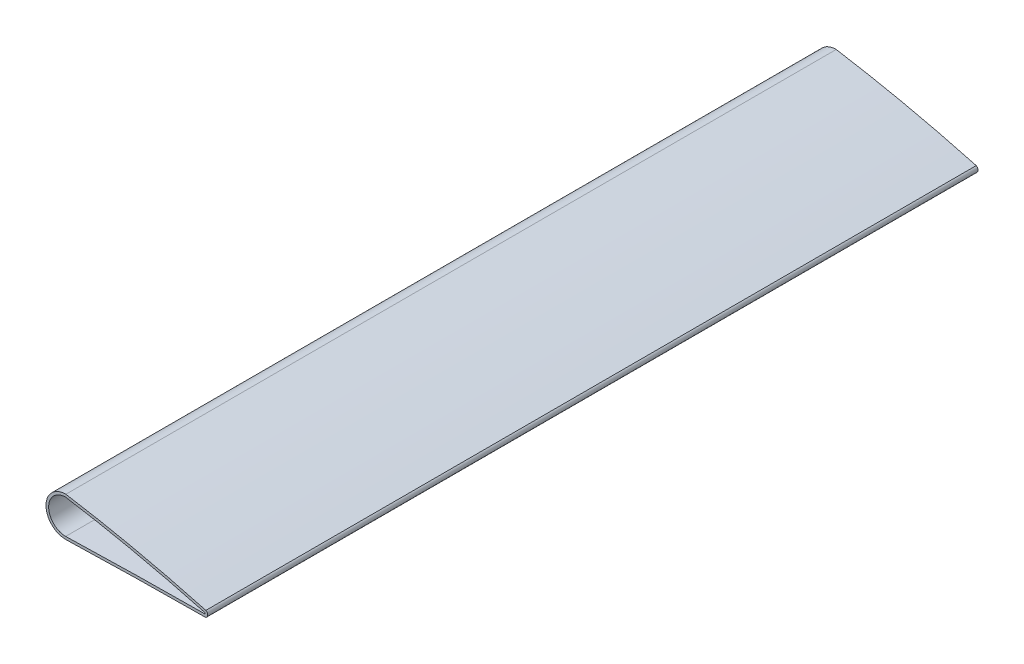
from build123d import *

# Parameters (mm, degrees)
THICKEN_START   = -486
THICKEN_1_DEPTH = 580.4


# Read off the part's stored shape, not the designer's step: Придать толщину1
with BuildPart() as part:
    # Придать толщину1 outline → Придать толщину1 (new body)
    with BuildSketch(Plane.XY.offset(THICKEN_START)):
        with BuildLine():
            ThreePointArc((350.530262234, -2.437269866), (352.176440725, -0.180662049), (350.855908905, 2.280715243))
            add(Edge.make_bspline(
                [(350.855908905, 2.280715243), (350.847341227, 2.283049319), (350.838773452, 2.285383421), (350.830205678, 2.287717523), (350.821637903, 2.290051626), (350.813070129, 2.292385728), (350.804502354, 2.294719831), (350.79593458, 2.297053933), (350.787366805, 2.299388035), (350.778799031, 2.301722138), (350.770231256, 2.30405624), (350.761663481, 2.306390342), (350.753095707, 2.308724445), (350.744527932, 2.311058547), (350.721223101, 2.317407438), (350.706486045, 2.321422226), (350.691748985, 2.325437014), (350.677011935, 2.329451802), (350.662274867, 2.33346659), (350.647537825, 2.337481378), (350.632800752, 2.341496166), (350.61806371, 2.345510955), (350.603326642, 2.349525743), (350.588589592, 2.353540531), (350.573852532, 2.357555319), (350.559115477, 2.361570107), (350.544378419, 2.365584895), (350.522272834, 2.371607077), (350.514923563, 2.373609253), (350.507299128, 2.375686214), (350.500660824, 2.377494496), (350.491767576, 2.379917309), (350.486631802, 2.381315638), (350.476720209, 2.384016224), (350.471520136, 2.385431796), (350.462702931, 2.387833891), (350.456026243, 2.389652051), (350.448396167, 2.391730226), (350.441070823, 2.39372521), (350.433682178, 2.395737404), (350.418917908, 2.399758121), (350.411535758, 2.401768425), (350.404153591, 2.403778673), (350.396771415, 2.405788865), (350.389389211, 2.407799003), (350.382007011, 2.409809085), (350.374624771, 2.411819112), (350.367242542, 2.413829084), (350.359860275, 2.415839001), (350.352478009, 2.417848863), (350.345095717, 2.419858669), (350.337713416, 2.42186842), (350.330331097, 2.423878115), (350.29341943, 2.433926318), (350.26388985, 2.441963997), (350.234360031, 2.450000791), (350.204829954, 2.458036702), (350.175299658, 2.466071729), (350.145769079, 2.474105871), (350.116238304, 2.48213913), (350.086707235, 2.490171505), (350.057175964, 2.498202995), (350.027644418, 2.506233601), (349.998112646, 2.514263323), (349.968580621, 2.52229216), (349.939048354, 2.530320112), (349.791385798, 2.570455453), (349.673251845, 2.602549572), (349.555113982, 2.634629532), (349.436972217, 2.666695331), (349.318826538, 2.698746961), (349.200676964, 2.73078442), (349.082523474, 2.762807702), (348.964366093, 2.794816803), (348.846204799, 2.826811719), (348.728039611, 2.858792444), (348.609870518, 2.890758973), (348.491697528, 2.922711304), (348.373520638, 2.95464943), (348.018978274, 3.050421181), (347.782601108, 3.114212179), (347.546208352, 3.177946305), (347.309800034, 3.241623522), (347.073376117, 3.305243792), (346.836936683, 3.368807079), (346.600481636, 3.432313345), (346.364011103, 3.495762554), (346.127524974, 3.559154669), (345.891023352, 3.622489653), (345.654506179, 3.685767468), (345.417973499, 3.748988079), (345.181425303, 3.812151447), (344.471734205, 4.001469715), (343.998544788, 4.127452777), (343.525293411, 4.253206428), (343.051980133, 4.378730371), (342.578605007, 4.504024311), (342.105168105, 4.629087953), (341.631669461, 4.753921), (341.158109163, 4.878523157), (340.684487238, 5.002894128), (340.210803771, 5.127033617), (339.737058801, 5.25094133), (339.263252398, 5.37461697), (338.789384613, 5.498060241), (337.367597294, 5.867692062), (336.419493796, 6.113182619), (335.47114547, 6.357740155), (334.522552802, 6.601362303), (333.57371621, 6.844046696), (332.624636238, 7.085790972), (331.67531324, 7.32659276), (330.725747809, 7.566449699), (329.775940285, 7.805359421), (328.825891233, 8.04331956), (327.875601051, 8.28032775), (326.92507024, 8.516381626), (325.974299248, 8.751478823), (324.072277843, 9.219755123), (323.121027933, 9.452934456), (322.169538251, 9.685152167), (321.217809283, 9.916405871), (320.265841965, 10.146693371), (319.313637196, 10.376012495), (318.361195636, 10.60436098), (317.408517503, 10.831736422), (316.455602753, 11.058136282), (315.502451221, 11.283557953), (314.549063115, 11.507998879), (313.595439546, 11.731456744), (312.641583319, 11.953929704), (310.733416382, 12.396903683), (309.779104108, 12.617405599), (308.824564208, 12.836922534), (307.86979786, 13.05545458), (306.914806244, 13.273001831), (305.959590541, 13.489564377), (305.004151926, 13.705142311), (304.048491585, 13.919735726), (303.09261069, 14.133344714), (302.136510427, 14.345969368), (301.18019197, 14.557609779), (300.223656501, 14.76826604), (299.266905199, 14.977938243), (296.396007332, 15.604002957), (294.481216806, 16.017443572), (292.565577101, 16.426949065), (290.649097646, 16.832520172), (288.731787881, 17.234157632), (286.813657228, 17.631862182), (284.894715137, 18.02563456), (282.974971019, 18.415475504), (281.054434331, 18.801385751), (279.133114486, 19.183366038), (277.211020932, 19.561417105), (275.288163092, 19.935539688), (273.364550405, 20.305734525), (270.47801325, 20.855136268), (269.515647844, 21.03728843), (268.553097263, 21.218458932), (267.590362686, 21.398647865), (266.62744529, 21.577855323), (265.664346259, 21.756081397), (264.701066764, 21.933326178), (263.737607993, 22.109589761), (262.773971118, 22.284872235), (261.810157321, 22.459173694), (260.846167781, 22.632494229), (259.882003676, 22.804833933), (258.917666186, 22.976192897), (257.47090164, 23.231760373), (256.98860374, 23.31670437), (256.506262936, 23.401403216), (256.023879374, 23.485856924), (255.541453205, 23.570065504), (255.058984569, 23.654028968), (254.576473624, 23.737747329), (254.093920506, 23.821220596), (253.611325372, 23.904448782), (253.128688363, 23.987431898), (252.64600963, 24.070169956), (252.163289318, 24.152662967), (251.680527575, 24.234910943), (250.956323037, 24.357915371), (250.714911203, 24.398855591), (250.473489068, 24.439734557), (250.232056644, 24.480552269), (249.990613966, 24.521308731), (249.749161023, 24.56200394), (249.507697873, 24.602637903), (249.26622449, 24.643210617), (249.024740936, 24.683722086), (248.783247192, 24.72417231), (248.541743303, 24.764561291), (248.300229273, 24.804889031), (248.058705126, 24.84515553), (247.696403756, 24.905463421), (247.575634108, 24.925550742), (247.454861934, 24.945622753), (247.334087249, 24.965679456), (247.213310029, 24.985720848), (247.092530319, 25.005746933), (246.971748063, 25.025757706), (246.85096333, 25.045753174), (246.730176058, 25.065733331), (246.609386302, 25.085698181), (246.488594028, 25.105647723), (246.367799258, 25.125581957), (246.247001987, 25.145500883), (246.096002277, 25.170380406), (246.065802179, 25.175355354), (246.035601922, 25.180329345), (246.00540152, 25.18530238), (245.975200939, 25.190274456), (245.945000238, 25.19524558), (245.914799335, 25.200215742), (245.884598326, 25.205184952), (245.854397116, 25.210153201), (245.824195784, 25.215120496), (245.793994275, 25.220086833), (245.763792621, 25.225052214), (245.733590808, 25.230016638), (245.695838348, 25.236220973), (245.688287846, 25.23746178), (245.680737334, 25.238702527), (245.673186814, 25.239943215), (245.66563628, 25.241183842), (245.658085744, 25.24242441), (245.650535188, 25.243664918), (245.642984633, 25.244905367), (245.635434059, 25.246145755), (245.627883482, 25.247386084), (245.620332891, 25.248626353), (245.612782293, 25.249866562), (245.605231684, 25.251106711), (245.593905756, 25.252966846), (245.590130444, 25.253586876), (245.586355132, 25.254206891), (245.582579811, 25.25482689), (245.5788045, 25.255446876), (245.575029166, 25.256066845), (245.571253858, 25.256686802), (245.567478516, 25.25730674), (245.5637032, 25.257926667), (245.55992786, 25.258546576), (245.556152532, 25.259166472), (245.552377193, 25.259786352), (245.548601856, 25.260406217), (245.542938844, 25.261335993), (245.541051175, 25.261645915), (245.539163499, 25.261955832), (245.537275836, 25.262265747), (245.535388145, 25.262575656), (245.533500499, 25.262885565), (245.531612792, 25.263195464), (245.529725149, 25.263505366), (245.527837448, 25.263815259), (245.52594979, 25.264125152), (245.524062104, 25.26443504), (245.522174431, 25.264744924), (245.520286752, 25.265054804), (245.516511396, 25.265674558), (245.5146231, 25.265984534), (245.512735772, 25.266294338), (245.510851599, 25.266603635), (245.508960848, 25.266914005), (245.507066649, 25.267224925), (245.505180733, 25.267534481), (245.503304717, 25.267842421), (245.501426209, 25.268150777), (245.499536503, 25.268460964), (245.497646641, 25.268771172), (245.495770176, 25.269079189), (245.493883748, 25.269388837), (245.481970707, 25.271344313), (245.471941721, 25.272990529), (245.461912734, 25.274636744), (245.451883748, 25.27628296), (245.441854762, 25.277929176), (245.431825776, 25.279575392), (245.421796789, 25.281221607), (245.411767803, 25.282867823), (245.401738817, 25.284514039), (245.391709831, 25.286160255), (245.381680844, 25.287806471), (245.371651858, 25.289452686), (245.361622872, 25.291098902), (245.351593885, 25.292745118)],
                knots=[-0.003188793, -0.003188793, -0.003188793, -0.003188793, -0.003188793, -0.003188793, -0.003188793, -0.003188793, -0.003188793, -0.003188793, -0.003188793, -0.003188793, -0.003188793, -0.003188793, -0.003188793, -0.002030469, -0.002030469, -0.002030469, -0.002030469, -0.002030469, -0.002030469, -0.002030469, -0.002030469, -0.002030469, -0.002030469, -0.002030469, -0.002030469, -0.002030469, -3.8086e-05, -3.8086e-05, -3.8086e-05, -3.8086e-05, -3.8086e-05, -3.8086e-05, -3.8086e-05, -3.8086e-05, -3.8086e-05, -3.8086e-05, -3.8086e-05, -3.8086e-05, -3.8086e-05, 0.000958105, 0.000958105, 0.000958105, 0.000958105, 0.000958105, 0.000958105, 0.000958105, 0.000958105, 0.000958105, 0.000958105, 0.000958105, 0.000958105, 0.000958105, 0.001954297, 0.001954297, 0.001954297, 0.001954297, 0.001954297, 0.001954297, 0.001954297, 0.001954297, 0.001954297, 0.001954297, 0.001954297, 0.001954297, 0.001954297, 0.005939062, 0.005939062, 0.005939062, 0.005939062, 0.005939062, 0.005939062, 0.005939062, 0.005939062, 0.005939062, 0.005939062, 0.005939062, 0.005939062, 0.005939062, 0.021878125, 0.021878125, 0.021878125, 0.021878125, 0.021878125, 0.021878125, 0.021878125, 0.021878125, 0.021878125, 0.021878125, 0.021878125, 0.021878125, 0.021878125, 0.05375625, 0.05375625, 0.05375625, 0.05375625, 0.05375625, 0.05375625, 0.05375625, 0.05375625, 0.05375625, 0.05375625, 0.05375625, 0.05375625, 0.05375625, 0.1175125, 0.1175125, 0.1175125, 0.1175125, 0.1175125, 0.1175125, 0.1175125, 0.1175125, 0.1175125, 0.1175125, 0.1175125, 0.1175125, 0.1175125, 0.245025, 0.245025, 0.245025, 0.245025, 0.245025, 0.245025, 0.245025, 0.245025, 0.245025, 0.245025, 0.245025, 0.245025, 0.245025, 0.3725375, 0.3725375, 0.3725375, 0.3725375, 0.3725375, 0.3725375, 0.3725375, 0.3725375, 0.3725375, 0.3725375, 0.3725375, 0.3725375, 0.3725375, 0.50005, 0.50005, 0.50005, 0.50005, 0.50005, 0.50005, 0.50005, 0.50005, 0.50005, 0.50005, 0.50005, 0.50005, 0.50005, 0.755075, 0.755075, 0.755075, 0.755075, 0.755075, 0.755075, 0.755075, 0.755075, 0.755075, 0.755075, 0.755075, 0.755075, 0.755075, 0.8825875, 0.8825875, 0.8825875, 0.8825875, 0.8825875, 0.8825875, 0.8825875, 0.8825875, 0.8825875, 0.8825875, 0.8825875, 0.8825875, 0.8825875, 0.94634375, 0.94634375, 0.94634375, 0.94634375, 0.94634375, 0.94634375, 0.94634375, 0.94634375, 0.94634375, 0.94634375, 0.94634375, 0.94634375, 0.94634375, 0.978221875, 0.978221875, 0.978221875, 0.978221875, 0.978221875, 0.978221875, 0.978221875, 0.978221875, 0.978221875, 0.978221875, 0.978221875, 0.978221875, 0.978221875, 0.994160938, 0.994160938, 0.994160938, 0.994160938, 0.994160938, 0.994160938, 0.994160938, 0.994160938, 0.994160938, 0.994160938, 0.994160938, 0.994160938, 0.994160938, 0.998145703, 0.998145703, 0.998145703, 0.998145703, 0.998145703, 0.998145703, 0.998145703, 0.998145703, 0.998145703, 0.998145703, 0.998145703, 0.998145703, 0.998145703, 0.999141895, 0.999141895, 0.999141895, 0.999141895, 0.999141895, 0.999141895, 0.999141895, 0.999141895, 0.999141895, 0.999141895, 0.999141895, 0.999141895, 0.999141895, 0.99963999, 0.99963999, 0.99963999, 0.99963999, 0.99963999, 0.99963999, 0.99963999, 0.99963999, 0.99963999, 0.99963999, 0.99963999, 0.99963999, 0.99963999, 0.999889038, 0.999889038, 0.999889038, 0.999889038, 0.999889038, 0.999889038, 0.999889038, 0.999889038, 0.999889038, 0.999889038, 0.999889038, 0.999889038, 0.999889038, 1.000138086, 1.000138086, 1.000138086, 1.000138086, 1.000138086, 1.000138086, 1.000138086, 1.000138086, 1.000138086, 1.000138086, 1.000138086, 1.000138086, 1.000138086, 1.001463789, 1.001463789, 1.001463789, 1.001463789, 1.001463789, 1.001463789, 1.001463789, 1.001463789, 1.001463789, 1.001463789, 1.001463789, 1.001463789, 1.001463789, 1.001463789, 1.001463789], degree=14))
            ThreePointArc((245.351593885, 25.292745118), (230.376934034, 10.556441311), (245.214345692, -4.31804368))
            add(Edge.make_bspline(
                [(245.214345692, -4.31804368), (245.216467002, -4.317978818), (245.218588312, -4.317913956), (245.220709621, -4.317849094), (245.222830931, -4.317784232), (245.224952241, -4.31771937), (245.227073551, -4.317654508), (245.22919486, -4.317589646), (245.23131617, -4.317524784), (245.23343748, -4.317459922), (245.23555879, -4.317395061), (245.237680099, -4.317330199), (245.257199522, -4.316733366), (245.274570665, -4.316202241), (245.291975274, -4.315670277), (245.309363737, -4.315138841), (245.326743207, -4.314607743), (245.344133783, -4.314076429), (245.361529897, -4.31354505), (245.378916513, -4.313014017), (245.396299366, -4.312483176), (245.413694183, -4.311952097), (245.43108137, -4.311421312), (245.483248108, -4.30982908), (245.518025946, -4.308767943), (245.552803795, -4.307707156), (245.587581657, -4.306646719), (245.622359529, -4.305586632), (245.657137415, -4.304526895), (245.691915311, -4.303467508), (245.726693221, -4.302408471), (245.761471141, -4.301349784), (245.796249074, -4.300291447), (245.831027019, -4.29923346), (246.004916802, -4.293945274), (246.144028819, -4.289720323), (246.283141027, -4.285500968), (246.422253423, -4.281287205), (246.561366012, -4.277079034), (246.700478787, -4.272876451), (246.839591755, -4.268679455), (246.978704909, -4.264488042), (247.117818254, -4.260302211), (247.256931786, -4.256121959), (247.396045507, -4.251947285), (247.813387235, -4.239439984), (248.091615806, -4.231124083), (248.369845127, -4.222830462), (248.648075198, -4.214559102), (248.926306014, -4.206309986), (249.204537577, -4.198083094), (249.482769881, -4.189878409), (249.761002928, -4.181695911), (250.039236713, -4.173535582), (250.317471236, -4.165397404), (250.595706493, -4.157281357), (251.430414468, -4.132999559), (251.986889384, -4.116900147), (252.543367219, -4.100889041), (253.099847958, -4.084966094), (253.656331584, -4.069131155), (254.212818083, -4.053384078), (254.76930744, -4.037724715), (255.325799638, -4.022152916), (255.882294664, -4.006668535), (256.438792501, -3.991271422), (256.995293135, -3.97596143), (258.664803379, -3.930292371), (259.777821333, -3.900194222), (260.890850288, -3.870442778), (262.003890124, -3.841036853), (263.116940716, -3.811975262), (264.230001946, -3.78325682), (265.343073687, -3.754880342), (266.45615582, -3.726844642), (267.569248221, -3.699148534), (268.682350769, -3.671790835), (269.795463341, -3.644770357), (273.134830764, -3.564717036), (275.361115321, -3.512692304), (277.587438508, -3.462002237), (279.813799348, -3.412637353), (282.04019686, -3.364588167), (284.266630071, -3.317845198), (286.493097998, -3.272398962), (288.719599666, -3.228239975), (290.946134095, -3.185358755), (293.172700308, -3.143745818), (295.399297326, -3.103391681), (299.852551017, -3.025182042), (302.07920769, -2.987326539), (304.305893212, -2.950710869), (306.532606604, -2.915325548), (308.75934689, -2.881161091), (310.986113087, -2.848208015), (313.212904221, -2.816456835), (315.43971931, -2.785898066), (317.666557379, -2.756522226), (319.893417447, -2.728319829), (322.120298536, -2.701281392), (325.460650235, -2.662455449), (326.574113072, -2.649801465), (327.687518826, -2.637438925), (328.801184122, -2.62535295), (329.914200848, -2.613554251), (331.028352183, -2.602088485), (332.141176246, -2.59075747), (333.255026923, -2.579929785), (334.368410156, -2.56920657), (335.481959579, -2.55881785), (336.595498864, -2.548660218), (338.265836672, -2.533788207), (338.822620185, -2.528891016), (339.37940793, -2.524052728), (339.936199892, -2.519272101), (340.492996062, -2.514547893), (341.049796421, -2.509878861), (341.606600965, -2.505263765), (342.163409673, -2.500701361), (342.720222537, -2.496190408), (343.277039543, -2.491729663), (343.833860678, -2.487317884), (344.669098555, -2.480771803), (344.94751221, -2.478601706), (345.225926893, -2.476443386), (345.504342601, -2.474296685), (345.782759334, -2.47216145), (346.061177089, -2.470037525), (346.339595867, -2.467924754), (346.618015663, -2.465822982), (346.896436477, -2.463732055), (347.174858308, -2.461651816), (347.453281153, -2.45958211), (347.870916941, -2.456493119), (348.010129124, -2.45546605), (348.14934156, -2.454441555), (348.288554248, -2.453419617), (348.42776719, -2.452400215), (348.566980384, -2.451383329), (348.70619383, -2.450368941), (348.845407528, -2.449357032), (348.984621478, -2.44834758), (349.12383568, -2.447340568), (349.263050134, -2.446335976), (349.437068515, -2.445083236), (349.471872207, -2.444832838), (349.506675913, -2.44458259), (349.541479638, -2.444332491), (349.576283375, -2.444082541), (349.611087133, -2.443832741), (349.6458909, -2.443583088), (349.680694688, -2.443333584), (349.715498489, -2.443084228), (349.750302307, -2.442835019), (349.78510614, -2.442585958), (349.837311913, -2.442212586), (349.854713914, -2.442088161), (349.872115752, -2.441963779), (349.889517563, -2.441839439), (349.906919525, -2.441715132), (349.924321678, -2.441590854), (349.941723858, -2.441466609), (349.959125786, -2.441342402), (349.976527263, -2.441218243), (349.993928529, -2.441094132), (350.011330728, -2.44097005), (350.046142331, -2.440721829), (350.063548132, -2.440597719), (350.080953934, -2.440473609), (350.098359735, -2.440349499), (350.115765537, -2.440225389), (350.133171337, -2.440101279), (350.15057714, -2.439977169), (350.16798294, -2.439853058), (350.185388742, -2.439728948), (350.202794544, -2.439604838), (350.220200345, -2.439480728), (350.261994154, -2.439182722), (350.286382161, -2.439008826), (350.310770168, -2.43883493), (350.335158176, -2.438661034), (350.359546183, -2.438487138), (350.38393419, -2.438313242), (350.408322198, -2.438139346), (350.432710205, -2.43796545), (350.457098212, -2.437791554), (350.48148622, -2.437617658), (350.505874227, -2.437443762), (350.530262234, -2.437269866)],
                knots=[-0.000281012, -0.000281012, -0.000281012, -0.000281012, -0.000281012, -0.000281012, -0.000281012, -0.000281012, -0.000281012, -0.000281012, -0.000281012, -0.000281012, -0.000281012, -3.8086e-05, -3.8086e-05, -3.8086e-05, -3.8086e-05, -3.8086e-05, -3.8086e-05, -3.8086e-05, -3.8086e-05, -3.8086e-05, -3.8086e-05, -3.8086e-05, 0.001954297, 0.001954297, 0.001954297, 0.001954297, 0.001954297, 0.001954297, 0.001954297, 0.001954297, 0.001954297, 0.001954297, 0.001954297, 0.005939062, 0.005939062, 0.005939062, 0.005939062, 0.005939062, 0.005939062, 0.005939062, 0.005939062, 0.005939062, 0.005939062, 0.005939062, 0.021878125, 0.021878125, 0.021878125, 0.021878125, 0.021878125, 0.021878125, 0.021878125, 0.021878125, 0.021878125, 0.021878125, 0.021878125, 0.05375625, 0.05375625, 0.05375625, 0.05375625, 0.05375625, 0.05375625, 0.05375625, 0.05375625, 0.05375625, 0.05375625, 0.05375625, 0.1175125, 0.1175125, 0.1175125, 0.1175125, 0.1175125, 0.1175125, 0.1175125, 0.1175125, 0.1175125, 0.1175125, 0.1175125, 0.245025, 0.245025, 0.245025, 0.245025, 0.245025, 0.245025, 0.245025, 0.245025, 0.245025, 0.245025, 0.245025, 0.50005, 0.50005, 0.50005, 0.50005, 0.50005, 0.50005, 0.50005, 0.50005, 0.50005, 0.50005, 0.50005, 0.755075, 0.755075, 0.755075, 0.755075, 0.755075, 0.755075, 0.755075, 0.755075, 0.755075, 0.755075, 0.755075, 0.8825875, 0.8825875, 0.8825875, 0.8825875, 0.8825875, 0.8825875, 0.8825875, 0.8825875, 0.8825875, 0.8825875, 0.8825875, 0.94634375, 0.94634375, 0.94634375, 0.94634375, 0.94634375, 0.94634375, 0.94634375, 0.94634375, 0.94634375, 0.94634375, 0.94634375, 0.978221875, 0.978221875, 0.978221875, 0.978221875, 0.978221875, 0.978221875, 0.978221875, 0.978221875, 0.978221875, 0.978221875, 0.978221875, 0.994160938, 0.994160938, 0.994160938, 0.994160938, 0.994160938, 0.994160938, 0.994160938, 0.994160938, 0.994160938, 0.994160938, 0.994160938, 0.998145703, 0.998145703, 0.998145703, 0.998145703, 0.998145703, 0.998145703, 0.998145703, 0.998145703, 0.998145703, 0.998145703, 0.998145703, 1.000138086, 1.000138086, 1.000138086, 1.000138086, 1.000138086, 1.000138086, 1.000138086, 1.000138086, 1.000138086, 1.000138086, 1.000138086, 1.002130469, 1.002130469, 1.002130469, 1.002130469, 1.002130469, 1.002130469, 1.002130469, 1.002130469, 1.002130469, 1.002130469, 1.002130469, 1.004922081, 1.004922081, 1.004922081, 1.004922081, 1.004922081, 1.004922081, 1.004922081, 1.004922081, 1.004922081, 1.004922081, 1.004922081, 1.004922081, 1.004922081], degree=12))
        make_face()
        with BuildLine():
            add(Edge.make_bspline(
                [(350, 0.441), (337.645527153, 3.806705337), (302.963112897, 12.606844702), (267.850515483, 19.572877356), (245.182668182, 23.29370881)],
                knots=[0, 0, 0, 0, 0.357914644, 1, 1, 1, 1], degree=3))
            ThreePointArc((350, 0.441), (350.182668182, 0), (350, -0.441))
            add(Edge.make_bspline(
                [(245.182668182, -2.318077567), (274.175597913, -1.4315791), (309.116621854, -0.766828518), (344.061048987, -0.483347038), (350, -0.441)],
                knots=[0, 0, 0, 0, 0.830047126, 1, 1, 1, 1], degree=3))
            ThreePointArc((245.182668182, -2.318077567), (232.376774993, 10.487815621), (245.182668182, 23.29370881))
        make_face(mode=Mode.SUBTRACT)
    extrude(amount=THICKEN_1_DEPTH)


solid = part.part
